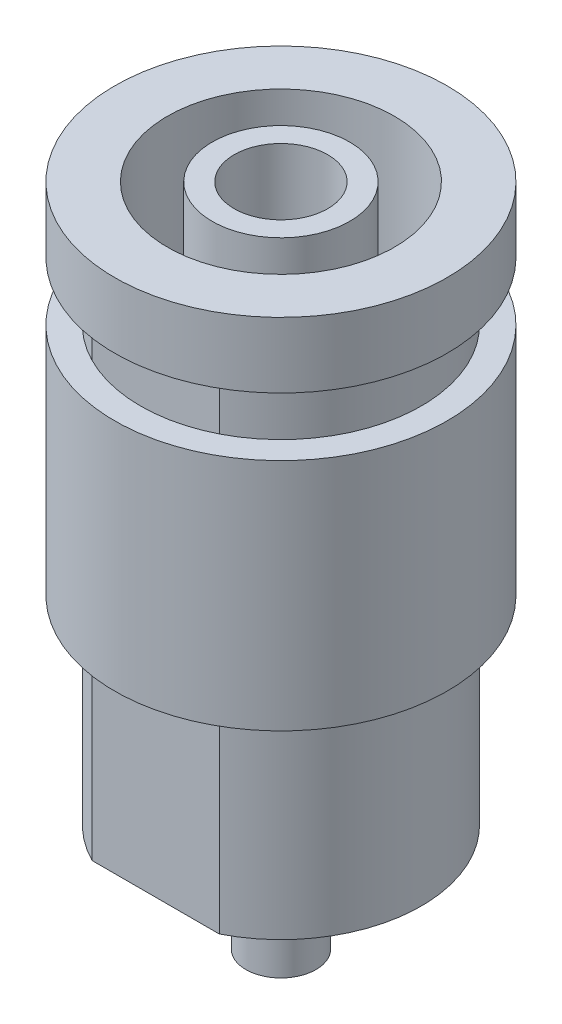
from build123d import *

# Parameters (mm, degrees)
CUT_EXTRUDE1_START = -21
CUT_EXTRUDE1_DEPTH = 21
SKETCH3_W          = 1.1
SKETCH3_H          = 10


# Read off the part's stored shape, not the designer's step: Cut-Extrude1
with BuildPart() as part:
    # Sketch1 → Revolve1 (revolve)
    with BuildSketch(Plane.XY, mode=Mode.PRIVATE) as revolve1_sk:
        Polygon((7.1, 0), (4.85, 0), (4.85, -21.710144928), (2.936727406, -21.710144928), (2.936727406, 0), (2, 0), (2, -21.710144928), (0, -21.710144928), (0, -24.747826087), (1, -24.747826087), (1, -28.4), (1.5, -28.4), (1.5, -24.747826087), (2.447826087, -23.8), (6, -23.8), (6, -2.8), (7.1, -2.8), align=None)
    revolve(revolve1_sk.sketch.rotate(Axis((0, -21.710144928, 0), (0, 1, 0)), 90), axis=Axis((0, -21.710144928, 0), (0, 1, 0)))

    # Cut-Extrude1 outline → Cut-Extrude1 (cut)
    with BuildSketch(Plane.XZ.offset(23.8).offset(CUT_EXTRUDE1_START)):
        with BuildLine():
            Line((2.716155371, -5.35), (-2.716155371, -5.35))
            ThreePointArc((-2.716155371, -5.35), (0, -6), (2.716155371, -5.35))
        make_face()
        with BuildLine():
            ThreePointArc((2.716155371, 5.35), (0, 6), (-2.716155371, 5.35))
            Line((-2.716155371, 5.35), (2.716155371, 5.35))
        make_face()
    extrude(amount=CUT_EXTRUDE1_DEPTH, mode=Mode.SUBTRACT)


with BuildPart() as body_2:
    # Sketch3 → Revolve2 (revolve)
    with BuildSketch(Plane.XY, mode=Mode.PRIVATE) as revolve2_sk:
        with Locations((6.55, -10.3)):
            Rectangle(SKETCH3_W, SKETCH3_H)
    revolve(revolve2_sk.sketch.rotate(Axis((0, -21.710144928, 0), (0, 1, 0)), 90), axis=Axis((0, -21.710144928, 0), (0, 1, 0)))


solid = Compound([part.part, body_2.part])
